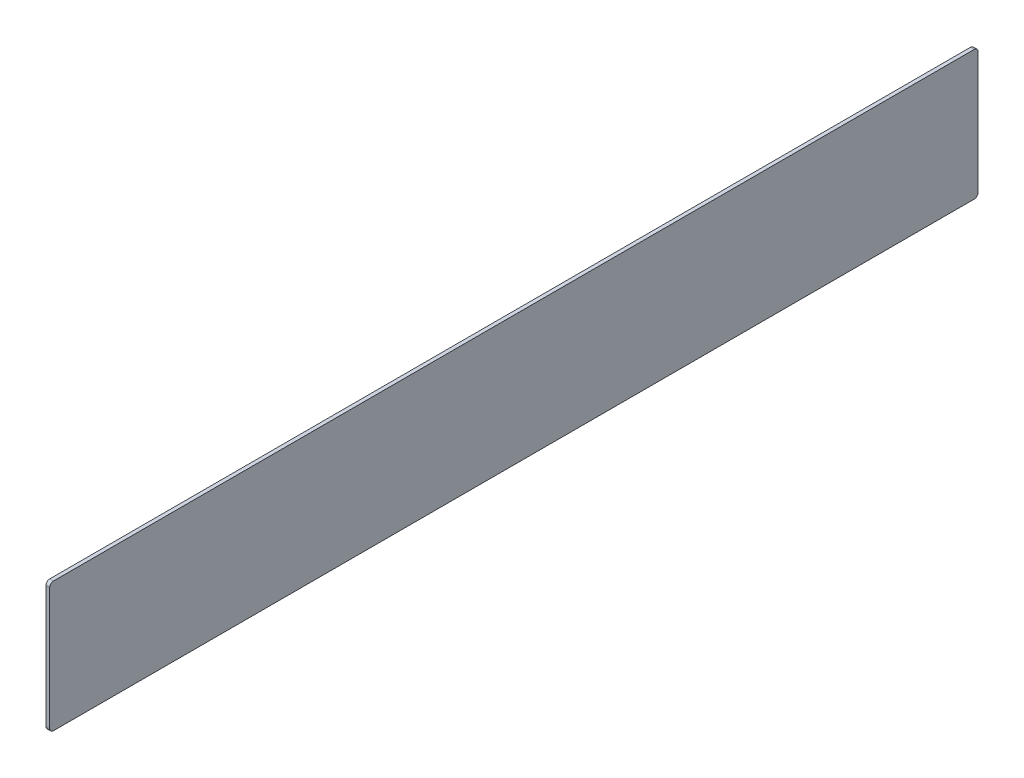
from build123d import *

# Parameters (mm, degrees)
SKETCH1_W           = 500
SKETCH1_H           = 69.85
BOSS_EXTRUDE1_DEPTH = 2
FILLET1_R           = 2


with BuildPart() as part:
    # Sketch1 → Boss-Extrude1 (new body)
    with BuildSketch(Plane(origin=(0, 0, 0), x_dir=(0, 0, -1), z_dir=(1, 0, 0))):
        with Locations((-19.946808511, -105.367553191)):
            Rectangle(SKETCH1_W, SKETCH1_H)
    extrude(amount=BOSS_EXTRUDE1_DEPTH)

    # Fillet1
    fillet1_edges = [part.edges().sort_by_distance(p)[0] for p in [
        (1, -140.292553191, -230.053191489),
        (1, -70.442553191, -230.053191489),
        (1, -140.292553191, 269.946808511),
        (1, -70.442553191, 269.946808511),
    ]]
    fillet(fillet1_edges, radius=FILLET1_R)


solid = part.part
